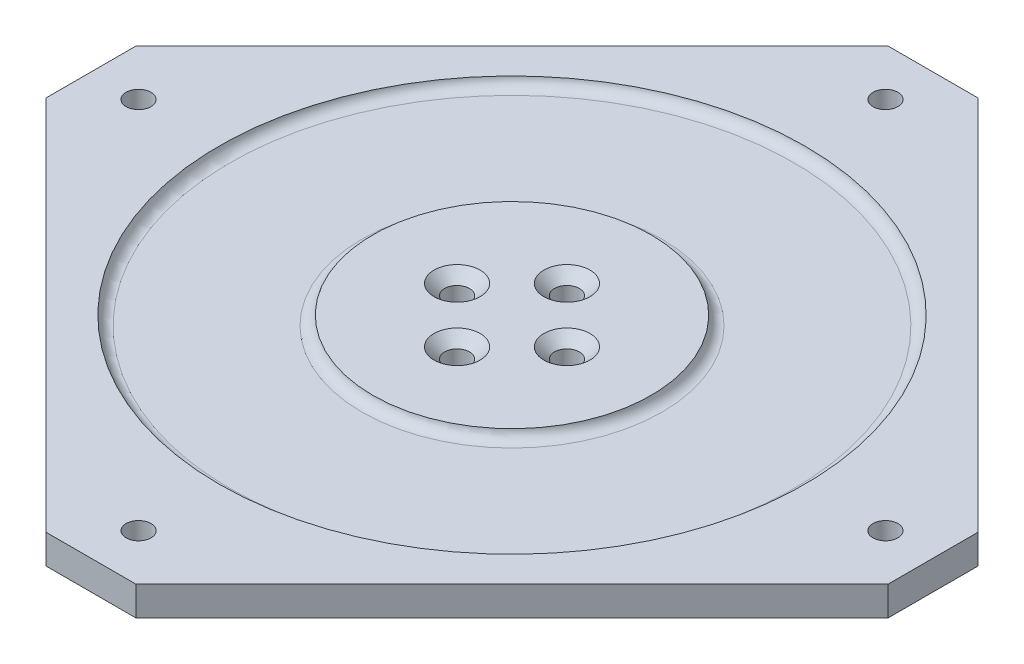
from build123d import *

# Parameters (mm, degrees)
MOUNTING_BASE_DEPTH                             = 4
CSK_FOR_M3_FLAT_HEAD_MACHINE_SCREW2_D           = 3.4
CSK_FOR_M3_FLAT_HEAD_MACHINE_SCREW2_DEPTH       = 4
CSK_FOR_M3_FLAT_HEAD_MACHINE_SCREW2_CSINK_D     = 6.3
CSK_FOR_M3_FLAT_HEAD_MACHINE_SCREW2_CSINK_ANGLE = 90
CSK_FOR_M3_FLAT_HEAD_MACHINE_SCREW2_TIP         = 1.021463052
CSK_FOR_M3_FLAT_HEAD_MACHINE_SCREW1_D           = 3.4
CSK_FOR_M3_FLAT_HEAD_MACHINE_SCREW1_CSINK_D     = 6.3
CSK_FOR_M3_FLAT_HEAD_MACHINE_SCREW1_CSINK_ANGLE = 90
SKETCH12_OUTSIDE_W                              = 165.288
SKETCH12_OUTSIDE_H                              = 165.288
SKETCH12_OUTSIDE_W_2                            = 115
SKETCH12_OUTSIDE_H_2                            = 115
CUT_EXTRUDE2_DEPTH                              = 20
SKETCH19_R                                      = 40
SKETCH19_R_2                                    = 19
CUT_EXTRUDE4_DEPTH                              = 1.25
CUT_EXTRUDE5_START                              = -4
SKETCH19_3_R                                    = 40
SKETCH19_3_R_2                                  = 19
CUT_EXTRUDE5_DEPTH                              = 1.25
FILLET1_R                                       = 1.5


with BuildPart() as part:
    # Sketch1 → Mounting base (new body)
    with BuildSketch(Plane(origin=(0, 0, 0), x_dir=(1, 0, 0), z_dir=(0, 1, 0))):
        Polygon((-63.639610307, 0), (0, -63.639610307), (63.639610307, 0), (0, 63.639610307), align=None)
    extrude(amount=MOUNTING_BASE_DEPTH)

    # CSK for M3 Flat Head Machine Screw2
    with Locations(Plane(origin=(0, 0, 0), x_dir=(-1, 0, 0), z_dir=(0, -1, 0))):
        with Locations((51, 0), (0, -51), (-51, 0), (0, 51)):
            CounterSinkHole(CSK_FOR_M3_FLAT_HEAD_MACHINE_SCREW2_D / 2, CSK_FOR_M3_FLAT_HEAD_MACHINE_SCREW2_CSINK_D / 2, depth=CSK_FOR_M3_FLAT_HEAD_MACHINE_SCREW2_DEPTH, counter_sink_angle=CSK_FOR_M3_FLAT_HEAD_MACHINE_SCREW2_CSINK_ANGLE)
            with Locations((0, 0, -(CSK_FOR_M3_FLAT_HEAD_MACHINE_SCREW2_DEPTH + CSK_FOR_M3_FLAT_HEAD_MACHINE_SCREW2_TIP / 2))):  # 118° drill point
                Cone(0, CSK_FOR_M3_FLAT_HEAD_MACHINE_SCREW2_D / 2, CSK_FOR_M3_FLAT_HEAD_MACHINE_SCREW2_TIP, mode=Mode.SUBTRACT)

    # CSK for M3 Flat Head Machine Screw1 (through all)
    with Locations(Plane(origin=(0, 4, -7.5), x_dir=(0, 0, 1), z_dir=(0, 1, 0))):
        with Locations((0, 0), (7.5, 7.5), (15, 0), (7.5, -7.5)):
            CounterSinkHole(CSK_FOR_M3_FLAT_HEAD_MACHINE_SCREW1_D / 2, CSK_FOR_M3_FLAT_HEAD_MACHINE_SCREW1_CSINK_D / 2, counter_sink_angle=CSK_FOR_M3_FLAT_HEAD_MACHINE_SCREW1_CSINK_ANGLE)

    # Sketch12 outside → Cut-Extrude2 (cut)
    with BuildSketch(Plane(origin=(0, 0, 0), x_dir=(1, 0, 0), z_dir=(0, 1, 0))):
        Rectangle(SKETCH12_OUTSIDE_W, SKETCH12_OUTSIDE_H)
        Rectangle(SKETCH12_OUTSIDE_W_2, SKETCH12_OUTSIDE_H_2, mode=Mode.SUBTRACT)
    extrude(amount=CUT_EXTRUDE2_DEPTH, mode=Mode.SUBTRACT)

    # Sketch19 → Cut-Extrude4 (cut)
    with BuildSketch(Plane(origin=(0, 4, 0), x_dir=(1, 0, 0), z_dir=(0, 1, 0))):
        with Locations(Location((0, 0, 0), (0, 0, 270))):
            Circle(SKETCH19_R)
        with Locations(Location((0, 0, 0), (0, 0, 270))):
            Circle(SKETCH19_R_2, mode=Mode.SUBTRACT)
    extrude(amount=-CUT_EXTRUDE4_DEPTH, mode=Mode.SUBTRACT)

    # Sketch19<3> → Cut-Extrude5 (cut)
    with BuildSketch(Plane(origin=(0, 4, 0), x_dir=(1, 0, 0), z_dir=(0, 1, 0)).offset(CUT_EXTRUDE5_START)):
        with Locations(Location((0, 0, 0), (0, 0, 270))):
            Circle(SKETCH19_3_R)
        with Locations(Location((0, 0, 0), (0, 0, 270))):
            Circle(SKETCH19_3_R_2, mode=Mode.SUBTRACT)
    extrude(amount=CUT_EXTRUDE5_DEPTH, mode=Mode.SUBTRACT)

    # Fillet1
    # the kernel refuses this fillet: 1.5 mm, written as the material it adds along each edge
    with BuildSketch(Plane(origin=(0, 2.75, 0), x_dir=(0, 0, 1), z_dir=(-1, 0, 0))) as fillet1_piece_1:
        with BuildLine():
            CenterArc((38.520980054, 1.5), FILLET1_R, 270, 80.405931773)
            Line((38.520980054, 0), (38.520980054, -0.03))
            Line((38.520980054, -0.03), (40, -0.03))
            Line((40, -0.03), (40.03, 0))
            ThreePointArc((40.03, 0), (40.03, 0.625), (40.029580399, 1.245))
            Line((40.029580399, 1.245), (40, 1.25))
        make_face()
    revolve(axis=Axis((0, 2.75, 0), (0, 1, 0)))
    with BuildSketch(Plane(origin=(0, 2.75, 0), x_dir=(0, 0, 1), z_dir=(-1, 0, 0))) as fillet1_piece_2:
        with BuildLine():
            CenterArc((20.479019946, 1.5), FILLET1_R, 189.594068227, 80.405931773)
            Line((19, 1.25), (18.970419601, 1.245))
            ThreePointArc((18.970419601, 1.245), (18.97, 0.625), (18.97, 0))
            Line((18.97, 0), (19, -0.03))
            Line((19, -0.03), (20.479019946, -0.03))
            Line((20.479019946, -0.03), (20.479019946, 0))
        make_face()
    revolve(axis=Axis((0, 2.75, 0), (0, 1, 0)))
    with BuildSketch(Plane(origin=(0, 1.25, 0), x_dir=(0, 0, 1), z_dir=(-1, 0, 0))) as fillet1_piece_3:
        with BuildLine():
            CenterArc((38.520980054, -1.5), FILLET1_R, 9.594068227, 80.405931773)
            Line((38.520980054, 0), (38.520980054, 0.03))
            Line((38.520980054, 0.03), (40, 0.03))
            Line((40, 0.03), (40.03, 0))
            ThreePointArc((40.03, 0), (40.03, -0.625), (40.029580399, -1.245))
            Line((40.029580399, -1.245), (40, -1.25))
        make_face()
    revolve(axis=Axis((0, 1.25, 0), (0, 1, 0)))
    with BuildSketch(Plane(origin=(0, 1.25, 0), x_dir=(0, 0, 1), z_dir=(-1, 0, 0))) as fillet1_piece_4:
        with BuildLine():
            CenterArc((20.479019946, -1.5), FILLET1_R, 90, 80.405931773)
            Line((19, -1.25), (18.970419601, -1.245))
            ThreePointArc((18.970419601, -1.245), (18.97, -0.625), (18.97, 0))
            Line((18.97, 0), (19, 0.03))
            Line((19, 0.03), (20.479019946, 0.03))
            Line((20.479019946, 0.03), (20.479019946, 0))
        make_face()
    revolve(axis=Axis((0, 1.25, 0), (0, 1, 0)))


solid = part.part
